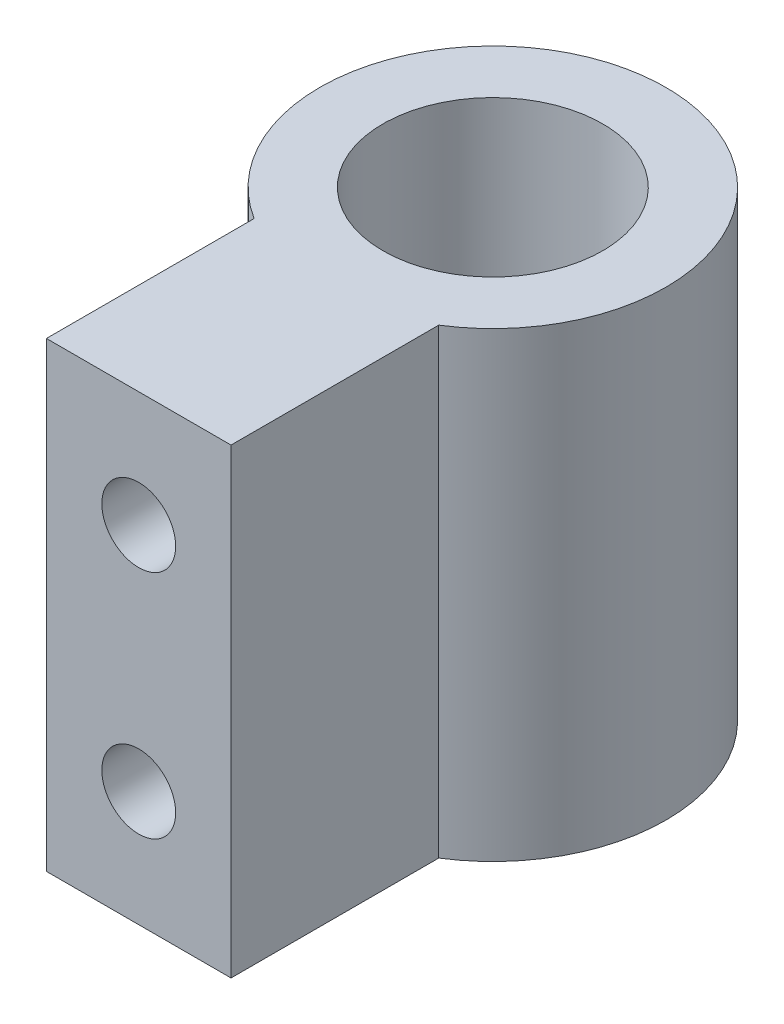
from build123d import *

# Parameters (mm, degrees)
SKETCH1_R           = 6.049999965
BOSS_EXTRUDE1_DEPTH = 25.4
SKETCH4_R           = 2.032
CUT_EXTRUDE2_DEPTH  = 12.7


with BuildPart() as part:
    # Sketch1 → Boss-Extrude1 (new body)
    with BuildSketch(Plane(origin=(0, 0, 0), x_dir=(1, 0, 0), z_dir=(0, 1, 0))):
        with BuildLine():
            Line((-5.08, -8.057246738), (-5.08, -19.487246738))
            Line((-5.08, -19.487246738), (5.08, -19.487246738))
            Line((5.08, -19.487246738), (5.08, -8.057246738))
            ThreePointArc((5.08, -8.057246738), (0, 9.525), (-5.08, -8.057246738))
        make_face()
        Circle(SKETCH1_R, mode=Mode.SUBTRACT)
    extrude(amount=BOSS_EXTRUDE1_DEPTH)

    # Sketch4 → Cut-Extrude2 (cut)
    with BuildSketch(Plane.XY.offset(19.487246738)):
        with Locations((0, 19.05)):
            Circle(SKETCH4_R)
        with Locations((0, 6.35)):
            Circle(SKETCH4_R)
    extrude(amount=-CUT_EXTRUDE2_DEPTH, mode=Mode.SUBTRACT)


solid = part.part
